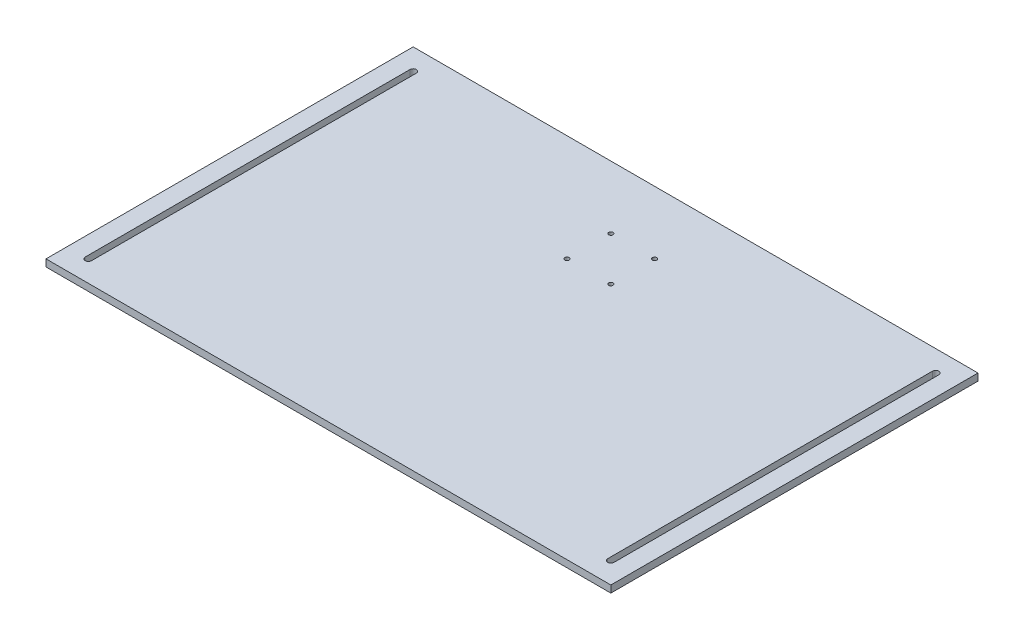
from build123d import *

# Parameters (mm, degrees)
SKETCH_1_W          = 400
SKETCH_1_H          = 260
EXTRUDE_1_DEPTH     = 5
CUT_EXTRUDE_1_DEPTH = 239.589605809
SKETCH_3_R          = 1.55
CUT_EXTRUDE_2_DEPTH = 239.589605809


with BuildPart() as part:
    # 草圖1 → 填料-伸長1 (new body)
    with BuildSketch(Plane(origin=(0, 0, 0), x_dir=(1, 0, 0), z_dir=(0, 1, 0))):
        Rectangle(SKETCH_1_W, SKETCH_1_H)
    extrude(amount=EXTRUDE_1_DEPTH)

    # 草圖2 → 除料-伸長1 (cut, through all)
    with BuildSketch(Plane(origin=(0, 5, 0), x_dir=(1, 0, 0), z_dir=(0, 1, 0))):
        with BuildLine():
            Line((-182.75, 115), (-182.75, -115))
            ThreePointArc((-182.75, -115), (-185, -117.25), (-187.25, -115))
            Line((-187.25, -115), (-187.25, 115))
            ThreePointArc((-187.25, 115), (-185, 117.25), (-182.75, 115))
        make_face()
        with BuildLine():
            Line((182.75, 115), (182.75, -115))
            ThreePointArc((182.75, -115), (185, -117.25), (187.25, -115))
            Line((187.25, -115), (187.25, 115))
            ThreePointArc((187.25, 115), (185, 117.25), (182.75, 115))
        make_face()
    extrude(amount=-CUT_EXTRUDE_1_DEPTH, mode=Mode.SUBTRACT)

    # 草圖3 → 除料-伸長2 (cut, through all)
    with BuildSketch(Plane(origin=(0, 5, 0), x_dir=(1, 0, 0), z_dir=(0, 1, 0))):
        with Locations((-15.5, 85.5)):
            Circle(SKETCH_3_R)
        with Locations((15.5, 85.5)):
            Circle(SKETCH_3_R)
        with Locations((-15.5, 54.5)):
            Circle(SKETCH_3_R)
        with Locations((15.5, 54.5)):
            Circle(SKETCH_3_R)
    extrude(amount=-CUT_EXTRUDE_2_DEPTH, mode=Mode.SUBTRACT)


solid = part.part
